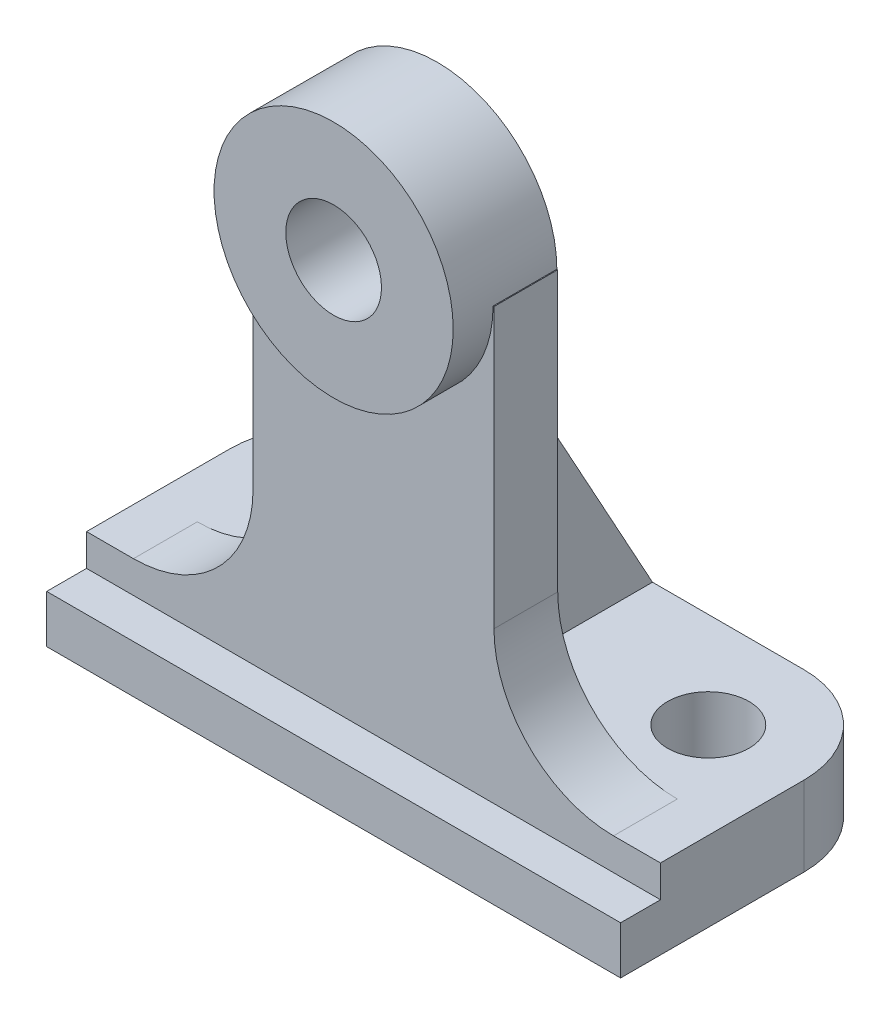
from build123d import *

# Parameters (mm, degrees)
BOSS_EXTRUDE1_DEPTH      = 36
BOSS_EXTRUDE1_DEPTH_BACK = 36
SKETCH2_R                = 6
BOSS_EXTRUDE4_DEPTH      = 8
BOSS_EXTRUDE5_START      = 5
SKETCH4_R                = 15
BOSS_EXTRUDE5_DEPTH      = 5
SKETCH6_R                = 6
CUT_EXTRUDE1_DEPTH       = 85.237758755
FILLET2_R                = 15
FILLET3_R                = 12
M12_TAPPED_HOLE1_D       = 10.2
RIB2_REACH               = 82.637
SKETCH9_WALL_W           = 208.923909208
SKETCH9_WALL_H           = 10


with BuildPart() as part:
    # Sketch1 → Boss-Extrude1 (new, two sides: drawn at the far end of the back side and taken through both)
    with BuildSketch(Plane(origin=(0, 0, 0), x_dir=(0, 0, -1), z_dir=(1, 0, 0)).offset(-BOSS_EXTRUDE1_DEPTH_BACK)):
        Polygon((-17.5, -5), (17.5, -5), (17.5, 5), (-12.5, 5), (-12.5, 1), (-17.5, 1), align=None)
    extrude(amount=BOSS_EXTRUDE1_DEPTH + BOSS_EXTRUDE1_DEPTH_BACK)

    # Sketch2 → Boss-Extrude4 (add)
    with BuildSketch(Plane.XY.offset(12.5)):
        with BuildLine():
            Line((15.111437298, 5), (15.111437298, 55))
            Line((15.111437298, 55), (15, 55))
            ThreePointArc((15, 55), (0, 70), (-15, 55))
            Line((-15, 55), (-15.111437298, 55))
            Line((-15.111437298, 55), (-15.111437298, 5))
            Line((-15.111437298, 5), (15.111437298, 5))
        make_face()
        with Locations((0, 55)):
            Circle(SKETCH2_R, mode=Mode.SUBTRACT)
    extrude(amount=-BOSS_EXTRUDE4_DEPTH)

    # Sketch4 → Boss-Extrude5 (add)
    with BuildSketch(Plane.XY.offset(12.5).offset(BOSS_EXTRUDE5_START)):
        with Locations((0, 55)):
            Circle(SKETCH4_R)
    extrude(amount=-BOSS_EXTRUDE5_DEPTH)

    # Sketch6 → Cut-Extrude1 (cut, through all)
    with BuildSketch(Plane(origin=(0, 0, 12.5), x_dir=(-1, 0, 0), z_dir=(0, 0, -1))):
        with Locations((0, 55)):
            Circle(SKETCH6_R)
    extrude(amount=-CUT_EXTRUDE1_DEPTH, mode=Mode.SUBTRACT)

    # Fillet2
    fillet2_edges = [part.edges().sort_by_distance(p)[0] for p in [
        (-15.111437298, 5, 8.5),
        (15.111437298, 5, 8.5),
    ]]
    fillet(fillet2_edges, radius=FILLET2_R)

    # Fillet3
    fillet3_edges = [part.edges().sort_by_distance(p)[0] for p in [
        (36, 0, -17.5),
        (-36, 0, -17.5),
    ]]
    fillet(fillet3_edges, radius=FILLET3_R)

    # M12 Tapped Hole1 (through all)
    with Locations(Plane(origin=(0, 5, 0), x_dir=(1, 0, 0), z_dir=(0, 1, 0))):
        with Locations((-24, 5.5), (24, 5.5)):
            Hole(M12_TAPPED_HOLE1_D / 2)

    # Sketch9 wall → Rib2 (add, up to next)
    with BuildSketch(Plane(origin=(0, 25, -6.5), x_dir=(0, 0.876215908677, 0.481918749772), z_dir=(0, -0.481918749772, 0.876215908677)), mode=Mode.PRIVATE) as rib2_sk1:
        Rectangle(SKETCH9_WALL_W, SKETCH9_WALL_H)
    rib2_tool1 = extrude(rib2_sk1.sketch, amount=RIB2_REACH, mode=Mode.PRIVATE) - part.part
    add(rib2_tool1.solids().sort_by_distance((0, 25, -6.5))[0])


solid = part.part
